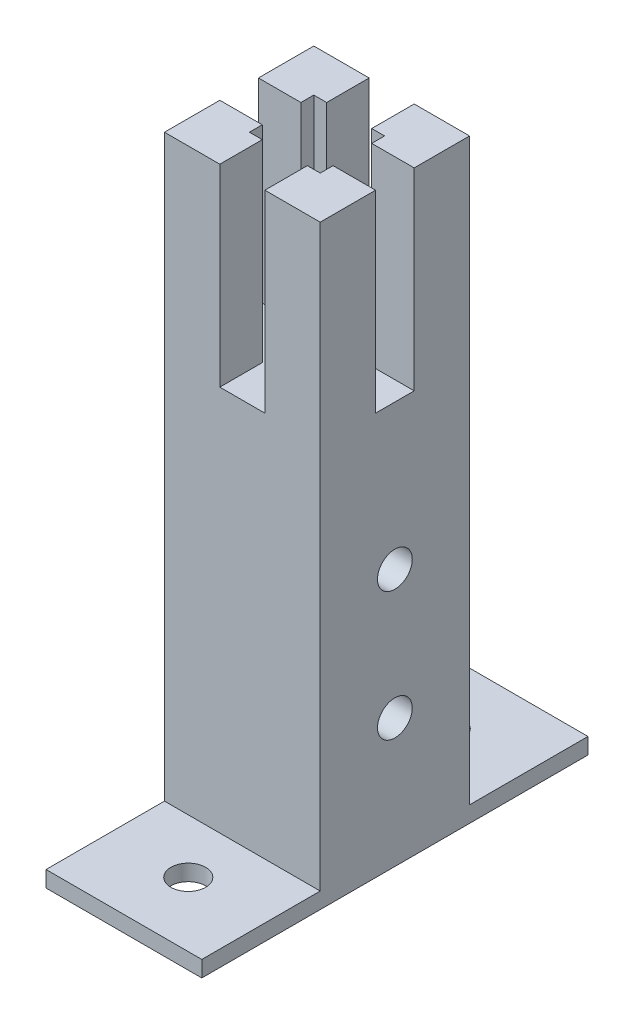
from build123d import *

# Parameters (mm, degrees)
BOSS_EXTRUDE1_DEPTH   = 38.1
BOSS_EXTRUDE1_2_DEPTH = 38.1
BOSS_EXTRUDE1_3_DEPTH = 38.1
BOSS_EXTRUDE1_4_DEPTH = 38.1
SKETCH2_W             = 30.734
SKETCH2_H             = 29.464
BOSS_EXTRUDE2_DEPTH   = 76.2
SKETCH3_W             = 30.734
SKETCH3_H             = 76.2
SKETCH3_R             = 3.429
BOSS_EXTRUDE3_DEPTH   = 3.175
SKETCH6_R             = 3.429
CUT_EXTRUDE3_DEPTH    = 90.376424822
LPATTERN1_COUNT       = 2
LPATTERN1_PITCH       = 25.4


with BuildPart() as part:
    # Sketch1 → Boss-Extrude1 (new body)
    with BuildSketch(Plane(origin=(0, 0, 0), x_dir=(1, 0, 0), z_dir=(0, 1, 0))):
        Polygon((-6.985, 6.35), (-6.985, 3.81), (-15.367, 3.81), (-15.367, 14.732), (-4.445, 14.732), (-4.445, 6.35), align=None)
    extrude(amount=BOSS_EXTRUDE1_DEPTH)



with BuildPart() as body_2:
    # Sketch1 → Boss-Extrude1 2 (new body)
    with BuildSketch(Plane(origin=(0, 0, 0), x_dir=(1, 0, 0), z_dir=(0, 1, 0))):
        Polygon((15.367, 3.81), (15.367, 14.732), (4.445, 14.732), (4.445, 6.35), (6.985, 6.35), (6.985, 3.81), align=None)
    extrude(amount=BOSS_EXTRUDE1_2_DEPTH)


with BuildPart() as body_3:
    # Sketch1 → Boss-Extrude1 3 (new body)
    with BuildSketch(Plane(origin=(0, 0, 0), x_dir=(1, 0, 0), z_dir=(0, 1, 0))):
        Polygon((6.985, -3.81), (15.367, -3.81), (15.367, -14.732), (4.445, -14.732), (4.445, -6.35), (6.985, -6.35), align=None)
    extrude(amount=BOSS_EXTRUDE1_3_DEPTH)


with BuildPart() as body_4:
    # Sketch1 → Boss-Extrude1 4 (new body)
    with BuildSketch(Plane(origin=(0, 0, 0), x_dir=(1, 0, 0), z_dir=(0, 1, 0))):
        Polygon((-6.985, -3.81), (-15.367, -3.81), (-15.367, -14.732), (-4.445, -14.732), (-4.445, -6.35), (-6.985, -6.35), align=None)
    extrude(amount=BOSS_EXTRUDE1_4_DEPTH)


with BuildPart() as part_1:
    add(part.part)

    add(body_2.part)  # Boss-Extrude2 merges body 2

    add(body_3.part)  # Boss-Extrude2 merges body 3

    add(body_4.part)  # Boss-Extrude2 merges body 4
    # Sketch2 → Boss-Extrude2 (add)
    with BuildSketch(Plane(origin=(0, 0, 0), x_dir=(-1, 0, 0), z_dir=(0, -1, 0))):
        Rectangle(SKETCH2_W, SKETCH2_H)
    extrude(amount=BOSS_EXTRUDE2_DEPTH)

    # Sketch3 → Boss-Extrude3 (add)
    with BuildSketch(Plane(origin=(0, -76.2, 0), x_dir=(-1, 0, 0), z_dir=(0, -1, 0))):
        Rectangle(SKETCH3_W, SKETCH3_H)
        with Locations((0, 25.4)):
            Circle(SKETCH3_R, mode=Mode.SUBTRACT)
        with Locations((0, -25.4)):
            Circle(SKETCH3_R, mode=Mode.SUBTRACT)
    extrude(amount=BOSS_EXTRUDE3_DEPTH)

    # Sketch6 → Cut-Extrude3 (cut, symmetric)
    with BuildSketch(Plane(origin=(0, 0, 0), x_dir=(0, 0, -1), z_dir=(1, 0, 0))):
        with Locations((0, -53.975)):
            Circle(SKETCH6_R)
    cut_extrude3 = extrude(amount=CUT_EXTRUDE3_DEPTH, both=True, mode=Mode.SUBTRACT)

    # LPattern1: Cut-Extrude3 ×2
    with Locations(*[(0, i * LPATTERN1_PITCH, 0) for i in range(1, LPATTERN1_COUNT)]):
        add(cut_extrude3, mode=Mode.SUBTRACT)


solid = part_1.part
